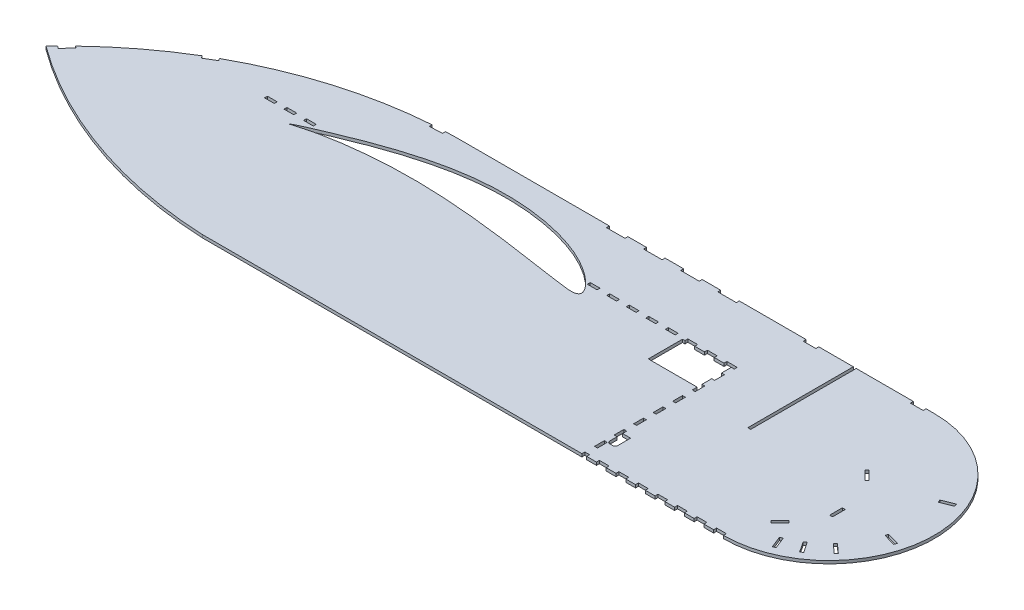
from build123d import *

# Parameters (mm, degrees)
BOSS_EXTRUDE1_DEPTH = 3
SKETCH2_W           = 3
SKETCH2_H           = 13
SKETCH2_W_2         = 13
SKETCH2_H_2         = 3
SKETCH2_W_3         = 19
SKETCH2_W_4         = 10
SKETCH2_H_3         = 10
SKETCH2_W_5         = 4.93
SKETCH2_H_4         = 108
CUT_EXTRUDE1_DEPTH  = 934.342916617


with BuildPart() as part:
    # Sketch1 → Boss-Extrude1 (new body)
    with BuildSketch(Plane(origin=(0, 0, 0), x_dir=(1, 0, 0), z_dir=(0, 1, 0))):
        with BuildLine():
            Line((266.408252791, 0), (800, 0))
            ThreePointArc((800, 0), (908, 108), (800, 216))
            Line((800, 216), (316.294556964, 216))
            ThreePointArc((316.294556964, 216), (154.432198565, 182.326352039), (19.429068043, 86.893169221))
            ThreePointArc((19.429068043, 86.893169221), (136.475600537, 25.133273094), (266.408252791, 0))
        make_face()
    extrude(amount=BOSS_EXTRUDE1_DEPTH)

    # Sketch2 → Cut-Extrude1 (cut, through all)
    with BuildSketch(Plane.XZ):
        Polygon((647.57, -153), (637.57, -153), (637.57, -156), (627.57, -156), (627.57, -153), (617.57, -153), (617.57, -156), (607.57, -156), (607.57, -153), (605.07, -153), (605.07, -118), (655.07, -118), (655.07, -113), (658.07, -113), (658.07, -123), (655.07, -123), (655.07, -133), (658.07, -133), (658.07, -143), (655.07, -143), (655.07, -153), (658.07, -153), (658.07, -156), (647.57, -156), align=None)
        Polygon((823.689305433, -121.232773417), (814.496917278, -130.425161573), (816.618237622, -132.546481916), (825.810625777, -123.354093761), align=None)
        Polygon((833.16064335, -28.105884629), (837.93522035, -16.014424235), (835.144883336, -14.912598773), (830.370306335, -27.004059167), align=None)
        with Locations((837.95655194, -78.816857664)):
            Rectangle(SKETCH2_W, SKETCH2_H)
        with BuildLine():
            Line((658.07, -25.473381029), (658.07, -33))
            Line((658.07, -33), (655.07, -33))
            Line((655.07, -33), (655.07, -43))
            Line((655.07, -43), (658.07, -43))
            Line((658.07, -43), (658.07, -38.673381029))
            Line((658.07, -38.673381029), (666.27, -38.673381029))
            Line((666.27, -38.673381029), (666.27, -25.473381029))
            ThreePointArc((666.27, -25.473381029), (665.537766953, -23.705614076), (663.77, -22.973381029))
            Line((663.77, -22.973381029), (660.57, -22.973381029))
            ThreePointArc((660.57, -22.973381029), (658.802233047, -23.705614076), (658.07, -25.473381029))
        make_face()
        with BuildLine():
            Line((212.57, -142.261782597), (212.57, -142.294782597))
            add(Edge.make_bspline(
                [(212.57, -142.294782597), (212.815137814, -142.460102486), (213.721483955, -143.071338431), (215.664179604, -144.220627165), (218.723437449, -145.777902142), (222.783765044, -147.580430449), (227.75908382, -149.780753256), (233.673151887, -152.372942719), (243.334631626, -156.473964415), (254.071597155, -160.928560196), (265.811315632, -165.551386352), (275.559769605, -169.192616013), (285.820264156, -172.789650289), (300.213165162, -177.442893994), (315.047470761, -181.61442891), (330.216772764, -185.078244178), (341.716798025, -187.262793988), (353.238408154, -188.970546018), (364.74982071, -190.189827969), (376.222154657, -190.889317525), (387.611451467, -191.086885836), (398.853751386, -190.764655348), (413.421420996, -189.696341642), (427.580802498, -187.700042396), (441.195366572, -184.827458978), (450.821943115, -182.319735681), (459.948918056, -179.469695278), (468.511745548, -176.287644359), (476.453624938, -172.824739179), (483.715148146, -169.128859345), (490.24814377, -165.284833696), (496.019667562, -161.40694583), (500.998027396, -157.585747413), (505.147593549, -153.884087589), (508.447339472, -150.382728864), (510.852240131, -147.180842115), (512.23052565, -144.518995071), (512.672376723, -142.438033672), (512.365957104, -140.693980261), (510.836297954, -139.267947677), (508.300825673, -138.604557497), (504.990749494, -138.396901122), (500.845143819, -138.632879923), (495.886387834, -139.207005807), (490.127383335, -140.033765729), (483.600688534, -141.01415409), (476.345974836, -142.081971784), (468.41886468, -143.270863791), (459.86962452, -144.552957933), (447.40415706, -146.414008038), (434.302787697, -148.29198326), (413.230560269, -151.080307043), (394.916461571, -153.170522792), (372.413070638, -155.185169178), (353.278576878, -156.497400442), (334.10390548, -157.12050793), (318.83753012, -157.119300437), (307.569298967, -156.863067348), (296.54483902, -156.342386113), (285.853643217, -155.59861473), (275.586288909, -154.654588864), (265.829573747, -153.556930461), (256.673464041, -152.312824912), (248.205041684, -150.95854436), (240.510067524, -149.523302558), (233.666056009, -148.064077742), (227.735558734, -146.629571507), (222.771530443, -145.20558608), (218.774640723, -143.912633605), (215.724793866, -142.995242016), (213.753356987, -142.496728121), (212.816237246, -142.310670921), (212.57, -142.261782597)],
                knots=[0, 0, 0, 0, 0.001413477, 0.005226038, 0.010781091, 0.017815608, 0.026460951, 0.036790889, 0.048685593, 0.076639155, 0.092362872, 0.109003461, 0.126386903, 0.144339126, 0.181312719, 0.200023431, 0.218712626, 0.237261299, 0.255692478, 0.274037197, 0.292192583, 0.310132767, 0.327788163, 0.362001934, 0.378421226, 0.394286639, 0.40954344, 0.424114253, 0.43793778, 0.450941833, 0.463044023, 0.474154417, 0.484164575, 0.493023962, 0.500713088, 0.507125739, 0.512129705, 0.514904185, 0.517171427, 0.520261618, 0.5242453, 0.529497961, 0.536092185, 0.54406114, 0.553363127, 0.563904543, 0.575614949, 0.588420092, 0.60222661, 0.616944448, 0.648675826, 0.665501113, 0.718564132, 0.736789145, 0.773513212, 0.810244924, 0.828488569, 0.846493195, 0.864125178, 0.88124851, 0.897725282, 0.913415058, 0.928184346, 0.941897285, 0.954411455, 0.965602702, 0.975349728, 0.983575522, 0.990284579, 0.99543259, 0.998799869, 1, 1, 1, 1], degree=3))
        make_face()
        Polygon((879.488683309, -142.12106628), (891.521725576, -147.041014837), (892.65709832, -144.264158929), (880.624056053, -139.344210373), align=None)
        Polygon((883.5475205, -85.58327061), (896.043113277, -81.997163924), (895.215550195, -79.113565591), (882.719957419, -82.699672277), align=None)
        Polygon((865.360730479, -51.33720048), (875.034295558, -42.652608454), (873.030158937, -40.420247282), (863.356593858, -49.104839308), align=None)
        Polygon((849.064781802, -36.758543494), (856.251694152, -25.925801881), (853.751830703, -24.267283646), (846.564918353, -35.10002526), align=None)
        Polygon((822.408918344, -44.734564455), (813.216530188, -35.542176299), (811.095209845, -37.663496643), (820.287598, -46.855884798), align=None)
        with Locations((785, -214.5)):
            Rectangle(SKETCH2_W_2, SKETCH2_H_2)
        with Locations((675.107627624, -214.5)):
            Rectangle(SKETCH2_W_2, SKETCH2_H_2)
        with Locations((590.701810534, -214.5)):
            Rectangle(SKETCH2_W_3, SKETCH2_H_2)
        with Locations((552.701810534, -214.5)):
            Rectangle(SKETCH2_W_3, SKETCH2_H_2)
        with Locations((514.701810534, -214.5)):
            Rectangle(SKETCH2_W_3, SKETCH2_H_2)
        with Locations((476.701810534, -214.5)):
            Rectangle(SKETCH2_W_3, SKETCH2_H_2)
        Polygon((286.653605669, -215.067910052), (299.639993398, -215.662665262), (299.777244601, -212.665806556), (286.790856872, -212.071051345), align=None)
        Polygon((107.891846949, -158.40758228), (119.051202256, -165.076074548), (120.590085087, -162.500838708), (109.43072978, -155.83234644), align=None)
        Polygon((25.225136805, -93.110530953), (34.089712558, -102.619437131), (36.284075522, -100.573765804), (27.419499769, -91.064859625), align=None)
        with Locations((532.57, -154.5)):
            Rectangle(SKETCH2_W_4, SKETCH2_H_2)
        with Locations((552.57, -154.5)):
            Rectangle(SKETCH2_W_4, SKETCH2_H_2)
        with Locations((572.57, -154.5)):
            Rectangle(SKETCH2_W_4, SKETCH2_H_2)
        with Locations((592.57, -154.5)):
            Rectangle(SKETCH2_W_4, SKETCH2_H_2)
        with Locations((656.57, -98)):
            Rectangle(SKETCH2_W, SKETCH2_H_3)
        with Locations((656.57, -78)):
            Rectangle(SKETCH2_W, SKETCH2_H_3)
        with Locations((656.57, -58)):
            Rectangle(SKETCH2_W, SKETCH2_H_3)
        with Locations((656.57, -18)):
            Rectangle(SKETCH2_W, SKETCH2_H_3)
        with Locations((657.535, -1.5)):
            Rectangle(SKETCH2_W_5, SKETCH2_H_2)
        with Locations((675, -1.5)):
            Rectangle(SKETCH2_W_4, SKETCH2_H_2)
        with Locations((695, -1.5)):
            Rectangle(SKETCH2_W_4, SKETCH2_H_2)
        with Locations((715, -1.5)):
            Rectangle(SKETCH2_W_4, SKETCH2_H_2)
        with Locations((735, -1.5)):
            Rectangle(SKETCH2_W_4, SKETCH2_H_2)
        with Locations((755, -1.5)):
            Rectangle(SKETCH2_W_4, SKETCH2_H_2)
        with Locations((775, -1.5)):
            Rectangle(SKETCH2_W_4, SKETCH2_H_2)
        with Locations((795, -1.5)):
            Rectangle(SKETCH2_W_4, SKETCH2_H_2)
        with Locations((182.07, -154.5)):
            Rectangle(SKETCH2_W_4, SKETCH2_H_2)
        with Locations((202.07, -154.5)):
            Rectangle(SKETCH2_W_4, SKETCH2_H_2)
        with Locations((222.07, -154.5)):
            Rectangle(SKETCH2_W_4, SKETCH2_H_2)
        with Locations((512.57, -154.5)):
            Rectangle(SKETCH2_W_4, SKETCH2_H_2)
        with Locations((718.5, -162)):
            Rectangle(SKETCH2_W, SKETCH2_H_4)
    extrude(amount=-CUT_EXTRUDE1_DEPTH, mode=Mode.SUBTRACT)


solid = part.part
